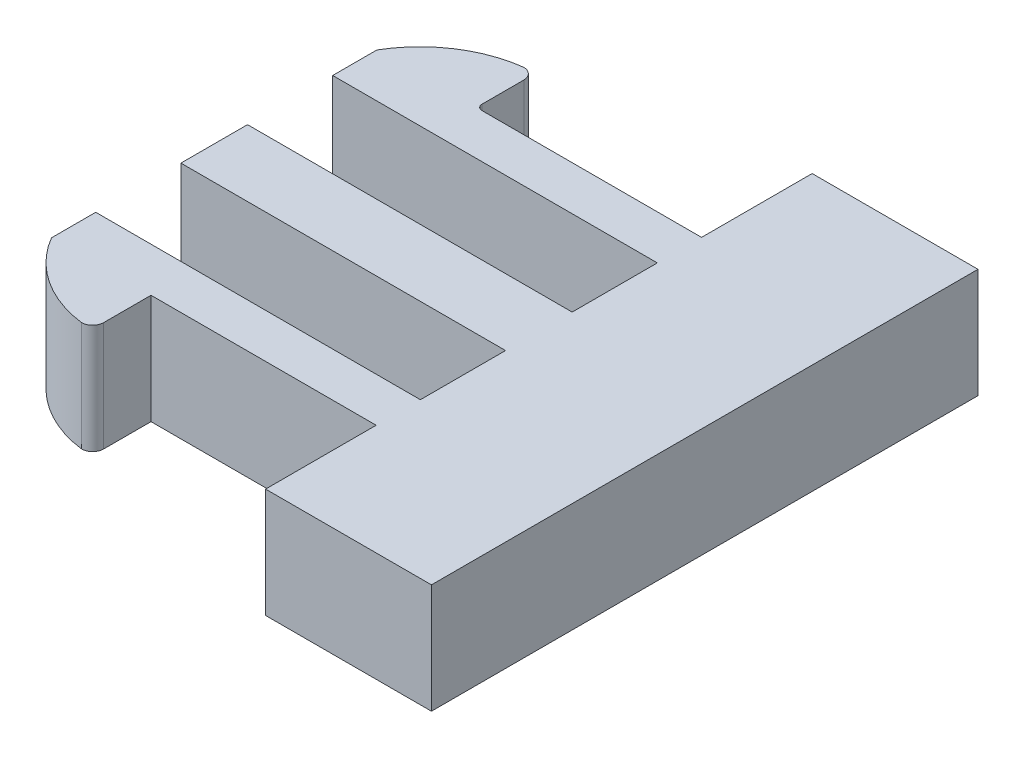
from build123d import *

# Parameters (mm, degrees)
SALIENTE_EXTRUIR1_DEPTH = 9.9


with BuildPart() as part:
    # Croquis1 → Saliente-Extruir1 (new body)
    with BuildSketch(Plane(origin=(0, 0, 0), x_dir=(1, 0, 0), z_dir=(0, 1, 0))):
        with BuildLine():
            Line((13.270197773, -14.714511134), (13.270197773, -24.714511134))
            Line((13.270197773, -24.714511134), (28.270197773, -24.714511134))
            Line((28.270197773, -24.714511134), (28.270197773, 24.714511134))
            Line((28.270197773, 24.714511134), (13.270197773, 24.714511134))
            Line((13.270197773, 24.714511134), (13.270197773, 14.714511134))
            Line((13.270197773, 14.714511134), (-6.590628095, 14.714511134))
            ThreePointArc((-6.590628095, 14.714511134), (-6.944181486, 14.860957744), (-7.090628095, 15.214511134))
            Line((-7.090628095, 15.214511134), (-7.090628095, 18.995462915))
            ThreePointArc((-7.090628095, 18.995462915), (-7.383521314, 19.702569696), (-8.090628095, 19.995462915))
            ThreePointArc((-8.090628095, 19.995462915), (-12.706365951, 18.287755027), (-16.090628095, 14.714511134))
            Line((-16.090628095, 14.714511134), (-16.090628095, 10.714511134))
            Line((-16.090628095, 10.714511134), (13.270197773, 10.714511134))
            Line((13.270197773, 10.714511134), (13.270197773, 8.214511134))
            Line((13.270197773, 8.214511134), (13.270197773, 5.212235466))
            Line((13.270197773, 5.212235466), (13.270197773, 5.012235466))
            Line((13.270197773, 5.012235466), (13.270197773, 3.012235466))
            Line((13.270197773, 3.012235466), (-16.090628095, 3.012235466))
            Line((-16.090628095, 3.012235466), (-16.090628095, -3.012235466))
            Line((-16.090628095, -3.012235466), (13.270197773, -3.012235466))
            Line((13.270197773, -3.012235466), (13.270197773, -5.012235466))
            Line((13.270197773, -5.012235466), (13.270197773, -5.212235466))
            Line((13.270197773, -5.212235466), (13.270197773, -8.214511134))
            Line((13.270197773, -8.214511134), (13.270197773, -10.714511134))
            Line((13.270197773, -10.714511134), (-16.090628095, -10.714511134))
            Line((-16.090628095, -10.714511134), (-16.090628095, -14.714511134))
            ThreePointArc((-16.090628095, -14.714511134), (-12.706365951, -18.287755027), (-8.090628095, -19.995462915))
            ThreePointArc((-8.090628095, -19.995462915), (-7.383521314, -19.702569696), (-7.090628095, -18.995462915))
            Line((-7.090628095, -18.995462915), (-7.090628095, -14.714511134))
            Line((-7.090628095, -14.714511134), (13.270197773, -14.714511134))
        make_face()
    extrude(amount=SALIENTE_EXTRUIR1_DEPTH)


solid = part.part
